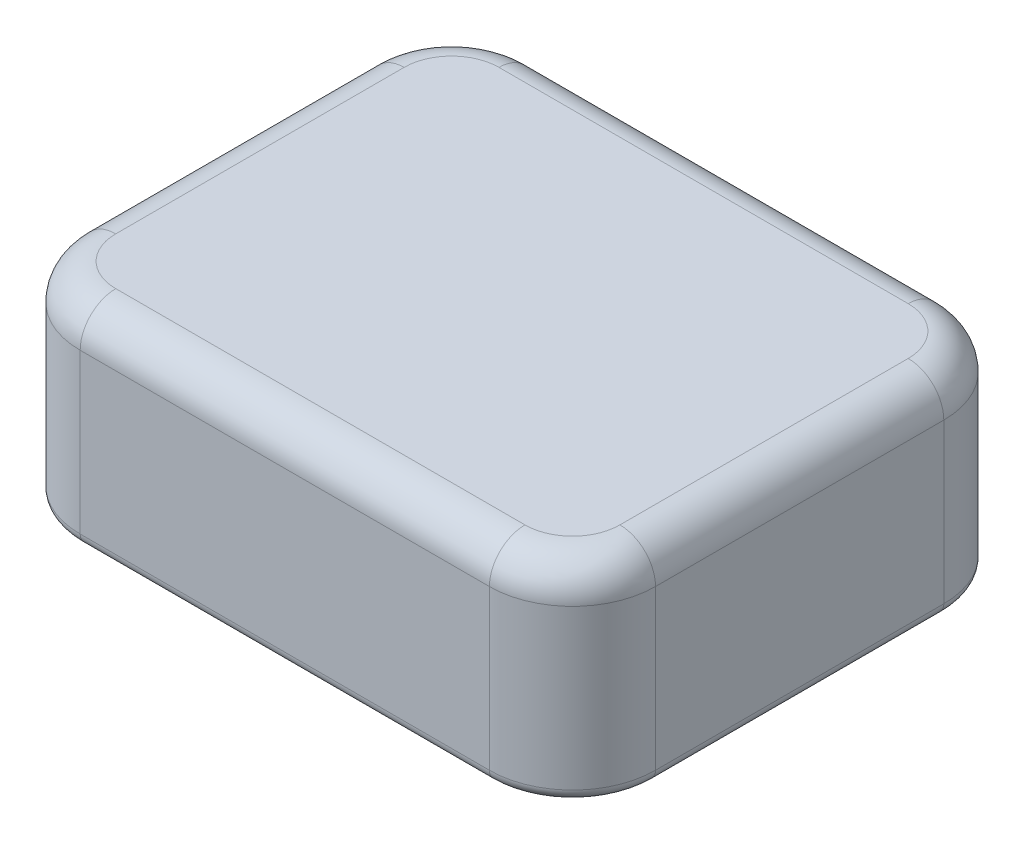
from build123d import *

# Parameters (mm, degrees)
SKETCH1_W           = 48.49
SKETCH1_H           = 38.3
BOSS_EXTRUDE1_DEPTH = 8.705
FILLET1_R           = 7
FILLET2_R           = 3
FILLET3_R           = 1


with BuildPart() as part:
    # Sketch1 → Boss-Extrude1 (new, symmetric)
    with BuildSketch(Plane(origin=(0, 0, 0), x_dir=(1, 0, 0), z_dir=(0, 1, 0))):
        Rectangle(SKETCH1_W, SKETCH1_H)
    extrude(amount=BOSS_EXTRUDE1_DEPTH, both=True)

    # Fillet1
    fillet1_edges = [part.edges().sort_by_distance(p)[0] for p in [
        (-24.245, 0, -19.15),
        (24.245, 0, -19.15),
        (24.245, 0, 19.15),
        (-24.245, 0, 19.15),
    ]]
    fillet(fillet1_edges, radius=FILLET1_R)

    # Fillet2
    fillet2_edges = [part.edges().sort_by_distance(p)[0] for p in [
        (-22.194747468, 8.705, 17.099747468),
        (-24.245, 8.705, 0),
        (-22.194747468, 8.705, -17.099747468),
        (0, 8.705, -19.15),
        (22.194747468, 8.705, -17.099747468),
        (24.245, 8.705, 0),
        (22.194747468, 8.705, 17.099747468),
        (0, 8.705, 19.15),
    ]]
    fillet(fillet2_edges, radius=FILLET2_R)

    # Fillet3
    fillet3_edges = [part.edges().sort_by_distance(p)[0] for p in [
        (-22.194747468, -8.705, 17.099747468),
        (-24.245, -8.705, 0),
        (-22.194747468, -8.705, -17.099747468),
        (0, -8.705, -19.15),
        (22.194747468, -8.705, -17.099747468),
        (24.245, -8.705, 0),
        (22.194747468, -8.705, 17.099747468),
        (0, -8.705, 19.15),
    ]]
    fillet(fillet3_edges, radius=FILLET3_R)


solid = part.part
